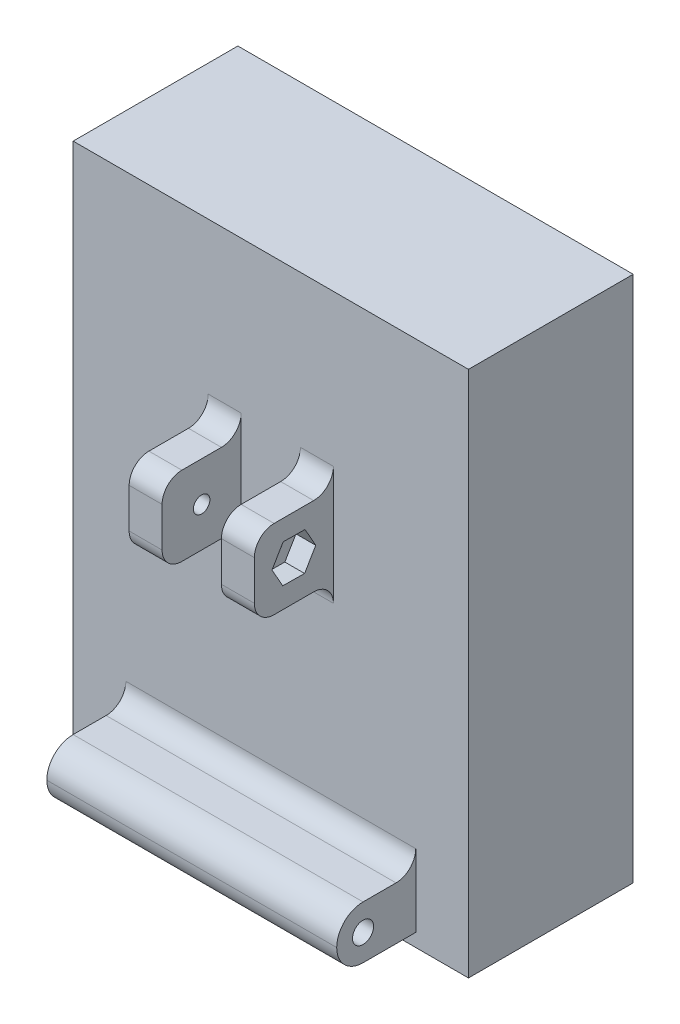
from build123d import *

# Parameters (mm, degrees)
SKETCH1_W           = 60
SKETCH1_H           = 25
BOSS_EXTRUDE1_DEPTH = 80
SKETCH2_W           = 44
SKETCH2_H           = 8
BOSS_EXTRUDE2_DEPTH = 12
SKETCH3_R           = 1.6
CUT_EXTRUDE1_DEPTH  = 99.510151761
FILLET1_R           = 4
CUT_EXTRUDE2_DEPTH  = 93.522970121
CUT_EXTRUDE3_DEPTH  = 3
SKETCH6_R           = 3.5
CUT_EXTRUDE4_DEPTH  = 3
FILLET2_R           = 3
FILLET3_R           = 3


with BuildPart() as part:
    # Sketch1 → Boss-Extrude1 (new body)
    with BuildSketch(Plane(origin=(0, 0, 0), x_dir=(1, 0, 0), z_dir=(0, 1, 0))):
        Rectangle(SKETCH1_W, SKETCH1_H)
    extrude(amount=BOSS_EXTRUDE1_DEPTH)

    # Sketch2 → Boss-Extrude2 (add)
    with BuildSketch(Plane.XY.offset(12.5)):
        with Locations((0, 6)):
            Rectangle(SKETCH2_W, SKETCH2_H)
        Polygon((-4.5, 48), (-4.5, 54), (-9.5, 54), (-9.5, 42), (-4.5, 42), align=None)
        Polygon((4.5, 48), (4.5, 54), (9.5, 54), (9.5, 42), (4.5, 42), align=None)
    extrude(amount=BOSS_EXTRUDE2_DEPTH)

    # Sketch3 → Cut-Extrude1 (cut, through all)
    with BuildSketch(Plane(origin=(22, 0, 0), x_dir=(0, 0, -1), z_dir=(1, 0, 0))):
        with Locations((-20.5, 6)):
            Circle(SKETCH3_R)
    extrude(amount=-CUT_EXTRUDE1_DEPTH, mode=Mode.SUBTRACT)

    # Fillet1
    fillet1_edges = [part.edges().sort_by_distance(p)[0] for p in [
        (0, 2, 24.5),
        (0, 10, 24.5),
    ]]
    fillet(fillet1_edges, radius=FILLET1_R - 0.0001)  # a hair under: the kernel refuses the full size

    # Sketch4 → Cut-Extrude2 (cut, through all)
    with BuildSketch(Plane(origin=(9.5, 0, 0), x_dir=(0, 0, -1), z_dir=(1, 0, 0))):
        with BuildLine():
            ThreePointArc((-17.25, 48), (-18.02164571, 49.154849416), (-19.383883476, 48.883883476))
            Line((-19.383883476, 48.883883476), (-17.616116524, 47.116116524))
            ThreePointArc((-17.616116524, 47.116116524), (-17.345150584, 47.52164571), (-17.25, 48))
        make_face()
        with BuildLine():
            Line((-17.616116524, 47.116116524), (-19.383883476, 48.883883476))
            ThreePointArc((-19.383883476, 48.883883476), (-19.383883476, 47.116116524), (-17.616116524, 47.116116524))
        make_face()
    extrude(amount=-CUT_EXTRUDE2_DEPTH, mode=Mode.SUBTRACT)

    # Sketch5 → Cut-Extrude3 (cut)
    with BuildSketch(Plane(origin=(9.5, 0, 0), x_dir=(0, 0, -1), z_dir=(1, 0, 0))):
        Polygon((-16.871380461, 45.107175821), (-15.180431003, 47.964013804), (-16.809050541, 50.856837983), (-20.128619539, 50.892824179), (-21.819568997, 48.035986196), (-20.190949459, 45.143162017), align=None)
    extrude(amount=-CUT_EXTRUDE3_DEPTH, mode=Mode.SUBTRACT)

    # Sketch6 → Cut-Extrude4 (cut)
    with BuildSketch(Plane.ZY.offset(9.5)):
        with Locations(Location((18.5, 48, 0), (0, 0, 270))):
            Circle(SKETCH6_R)
    extrude(amount=-CUT_EXTRUDE4_DEPTH, mode=Mode.SUBTRACT)

    # Fillet2
    fillet2_edges = [part.edges().sort_by_distance(p)[0] for p in [
        (-7, 54, 24.5),
        (-7, 42, 24.5),
        (7, 42, 24.5),
        (7, 54, 24.5),
    ]]
    fillet(fillet2_edges, radius=FILLET2_R)

    # Fillet3
    fillet3_edges = [part.edges().sort_by_distance(p)[0] for p in [
        (0, 10, 12.5),
        (-7, 54, 12.5),
        (-7, 42, 12.5),
        (7, 42, 12.5),
        (7, 54, 12.5),
    ]]
    fillet(fillet3_edges, radius=FILLET3_R)


solid = part.part
